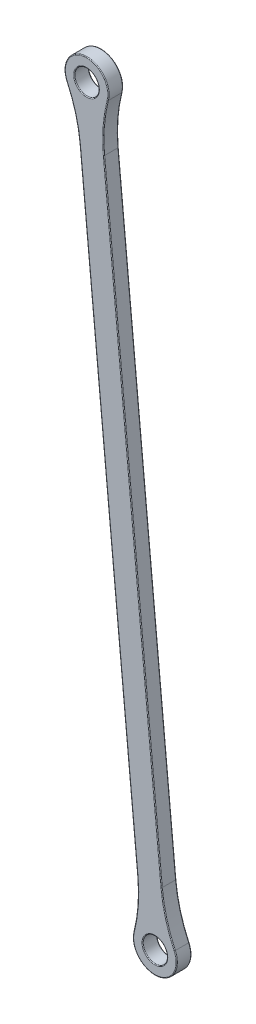
from build123d import *

# Parameters (mm, degrees)
SKETCH2_R           = 2.5
BOSS_EXTRUDE2_DEPTH = 3
FILLET1_R           = 30
FILLET2_R           = 0.15


with BuildPart() as part:
    # Sketch2 → Boss-Extrude2 (new body)
    with BuildSketch(Plane.XY):
        with BuildLine():
            ThreePointArc((11.656441803, 84.98771799), (14.926739013, 77.020279717), (16.633908784, 85.461872449))
            Line((16.633908784, 85.461872449), (3.308586221, 225.345304654))
            ThreePointArc((3.308586221, 225.345304654), (0.038289011, 233.312742928), (-1.66888076, 224.871150196))
            Line((-1.66888076, 224.871150196), (11.656441803, 84.98771799))
        make_face()
        with Locations((14.5, 81.5)):
            Circle(SKETCH2_R, mode=Mode.SUBTRACT)
        with Locations((0.465028024, 228.833022645)):
            Circle(SKETCH2_R, mode=Mode.SUBTRACT)
    extrude(amount=-BOSS_EXTRUDE2_DEPTH)

    # Fillet1
    fillet1_edges = [part.edges().sort_by_distance(p)[0] for p in [
        (16.633908784, 85.461872449, -1.5),
        (3.308586221, 225.345304654, -1.5),
        (-1.66888076, 224.871150196, -1.5),
        (11.656441803, 84.98771799, -1.5),
    ]]
    fillet(fillet1_edges, radius=FILLET1_R)

    # Fillet2
    fillet2_edges = [part.edges().sort_by_distance(p)[0] for p in [
        (12, 81.5, -3),
        (4.003161866, 222.672486217, -3),
        (0.038289011, 233.312742928, -3),
        (-1.846316938, 222.115263745, -3),
        (4.993780521, 154.929434093, -3),
        (10.961866157, 87.660536427, -3),
        (14.926739013, 77.020279717, -3),
        (16.811344962, 88.217758899, -3),
        (9.971247502, 155.403588552, -3),
        (-2.034971976, 228.833022645, -3),
        (12, 81.5, 0),
        (10.961866157, 87.660536427, 0),
        (4.993780521, 154.929434093, 0),
        (-1.846316938, 222.115263745, 0),
        (0.038289011, 233.312742928, 0),
        (4.003161866, 222.672486217, 0),
        (9.971247502, 155.403588552, 0),
        (16.811344962, 88.217758899, 0),
        (14.926739013, 77.020279717, 0),
        (-2.034971976, 228.833022645, 0),
    ]]
    fillet(fillet2_edges, radius=FILLET2_R)


solid = part.part
